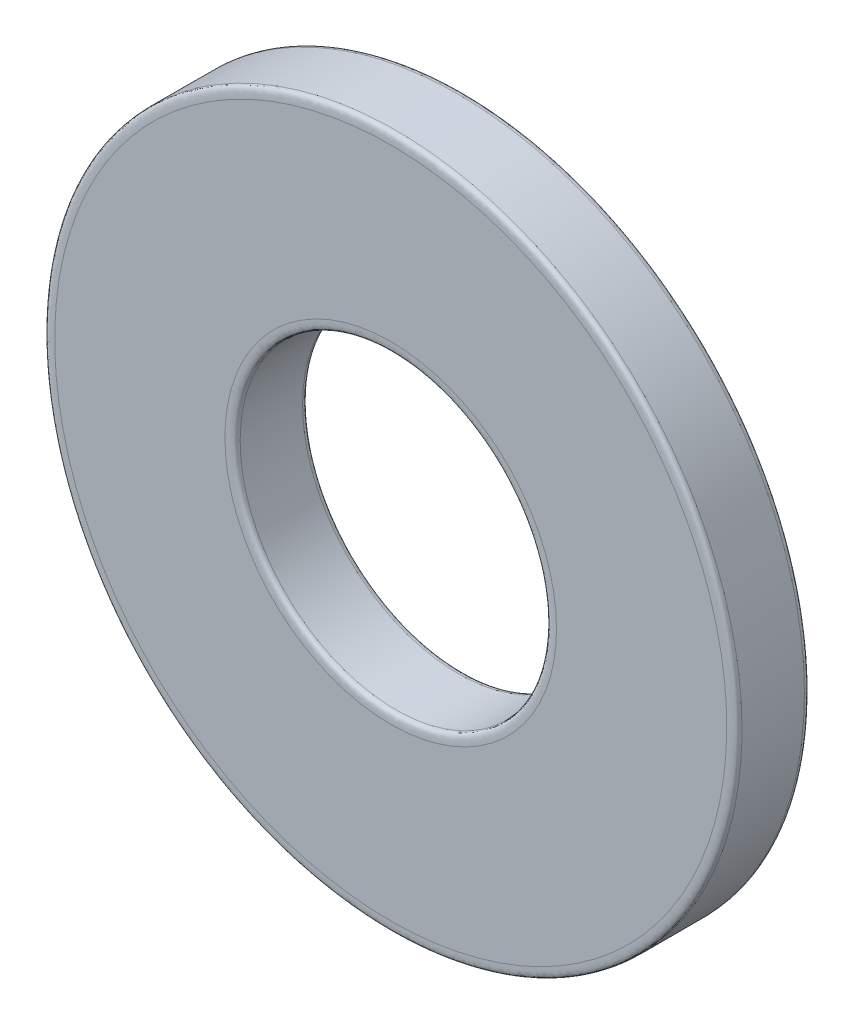
from build123d import *

# Parameters (mm, degrees)
SKETCH3_R           = 7.9375
SKETCH3_R_2         = 3.5687
BOSS_EXTRUDE1_DEPTH = 0.83185
FILLET1_SIZE        = 0.116459
FILLET1_SIZE_2      = 0.232918


with BuildPart() as part:
    # Sketch3 → Boss-Extrude1 (new, symmetric)
    with BuildSketch(Plane.XY):
        Circle(SKETCH3_R)
        Circle(SKETCH3_R_2, mode=Mode.SUBTRACT)
    extrude(amount=BOSS_EXTRUDE1_DEPTH, both=True)

    # Fillet1
    # a fillet whose section is not a circle: 0.232918, 0.116459 mm, written as the material it takes off along each edge
    with BuildSketch(Plane(origin=(0, 0, -0.83185), x_dir=(1, 0, 0), z_dir=(0, -1, 0))) as fillet1_piece_1:
        with BuildLine():
            Bezier((7.9375, FILLET1_SIZE), (7.9375, 0), (7.9375 - FILLET1_SIZE_2, 0), weights=[1, 1.857142857, 1])
            Line((7.9375 - FILLET1_SIZE_2, 0), (7.9375, 0))
            Line((7.9375, 0), (7.9375, FILLET1_SIZE))
        make_face()
    revolve(axis=Axis((0, 0, -0.83185), (0, 0, 1)), mode=Mode.SUBTRACT)
    with BuildSketch(Plane(origin=(0, 0, 0.83185), x_dir=(1, 0, 0), z_dir=(0, -1, 0))) as fillet1_piece_2:
        with BuildLine():
            Bezier((7.9375, -FILLET1_SIZE), (7.9375, 0), (7.9375 - FILLET1_SIZE_2, 0), weights=[1, 1.857142857, 1])
            Line((7.9375 - FILLET1_SIZE_2, 0), (7.9375, 0))
            Line((7.9375, 0), (7.9375, -FILLET1_SIZE))
        make_face()
    revolve(axis=Axis((0, 0, 0.83185), (0, 0, 1)), mode=Mode.SUBTRACT)
    with BuildSketch(Plane(origin=(0, 0, -0.83185), x_dir=(1, 0, 0), z_dir=(0, -1, 0))) as fillet1_piece_3:
        with BuildLine():
            Bezier((3.5687, FILLET1_SIZE), (3.5687, 0), (3.5687 + FILLET1_SIZE_2, 0), weights=[1, 1.857142857, 1])
            Line((3.5687 + FILLET1_SIZE_2, 0), (3.5687, 0))
            Line((3.5687, 0), (3.5687, FILLET1_SIZE))
        make_face()
    revolve(axis=Axis((0, 0, -0.83185), (0, 0, 1)), mode=Mode.SUBTRACT)
    with BuildSketch(Plane(origin=(0, 0, 0.83185), x_dir=(1, 0, 0), z_dir=(0, -1, 0))) as fillet1_piece_4:
        with BuildLine():
            Bezier((3.5687 + FILLET1_SIZE_2, 0), (3.5687, 0), (3.5687, -FILLET1_SIZE), weights=[1, 1.857142857, 1])
            Line((3.5687, -FILLET1_SIZE), (3.5687, 0))
            Line((3.5687, 0), (3.5687 + FILLET1_SIZE_2, 0))
        make_face()
    revolve(axis=Axis((0, 0, 0.83185), (0, 0, 1)), mode=Mode.SUBTRACT)


solid = part.part
